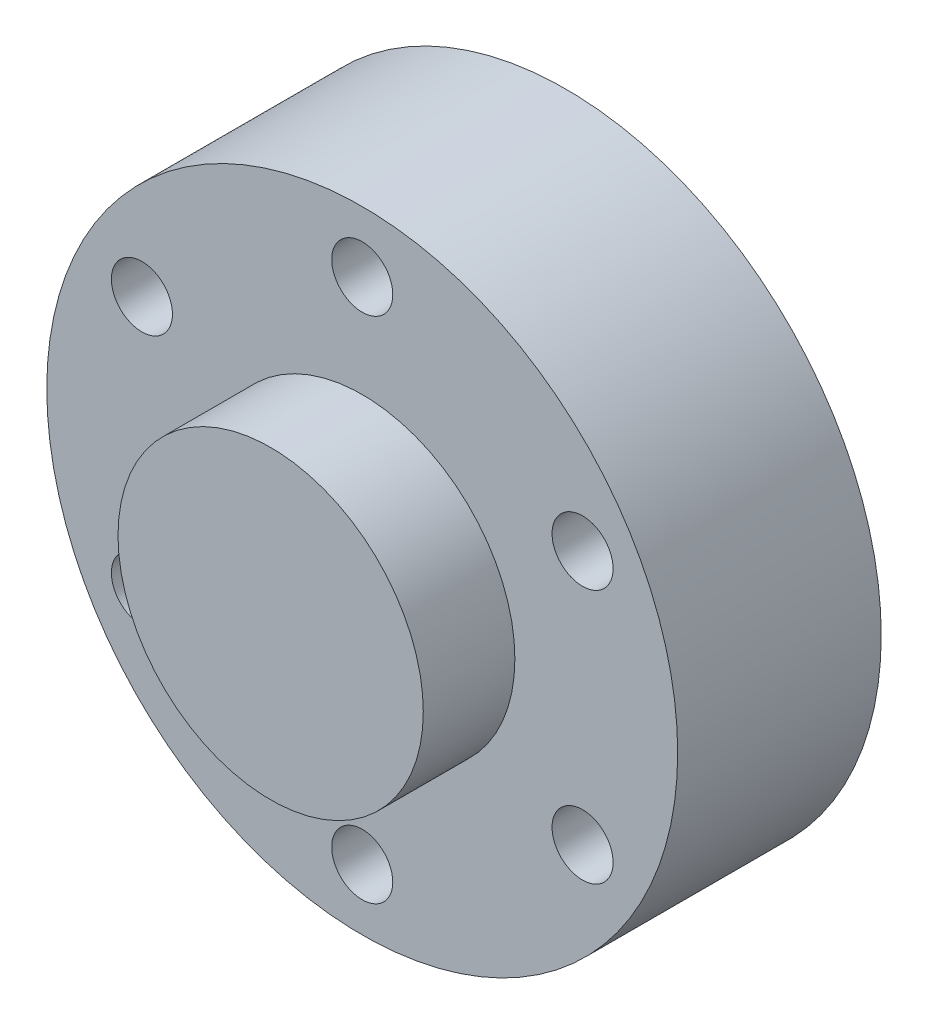
from build123d import *

# Parameters (mm, degrees)
SKETCH2_R           = 15.5
SKETCH2_R_2         = 1.5
BOSS_EXTRUDE1_DEPTH = 10
SKETCH3_R           = 7.5
BOSS_EXTRUDE2_DEPTH = 4.5
BOSS_EXTRUDE4_START = 4.5
SKETCH6_R           = 7.5
BOSS_EXTRUDE4_DEPTH = 4.5
SKETCH7_R           = 2
BOSS_EXTRUDE5_DEPTH = 1
FILLET2_R           = 0.05
CUT_EXTRUDE1_DEPTH  = 11


with BuildPart() as part:
    # Sketch2 → Boss-Extrude1 (new body)
    with BuildSketch(Plane.XY):
        Circle(SKETCH2_R)
        with Locations((0, -12.5)):
            Circle(SKETCH2_R_2, mode=Mode.SUBTRACT)
        with Locations((-10.825317547, -6.25)):
            Circle(SKETCH2_R_2, mode=Mode.SUBTRACT)
        with Locations((10.825317547, -6.25)):
            Circle(SKETCH2_R_2, mode=Mode.SUBTRACT)
        with Locations((-10.825317547, 6.25)):
            Circle(SKETCH2_R_2, mode=Mode.SUBTRACT)
        with Locations((0, 12.5)):
            Circle(SKETCH2_R_2, mode=Mode.SUBTRACT)
        with Locations((10.825317547, 6.25)):
            Circle(SKETCH2_R_2, mode=Mode.SUBTRACT)
    extrude(amount=BOSS_EXTRUDE1_DEPTH)

    # Sketch3 → Boss-Extrude2 (add)
    with BuildSketch(Plane.XY.offset(10)):
        Circle(SKETCH3_R)
    extrude(amount=BOSS_EXTRUDE2_DEPTH)

    # Sketch6 → Boss-Extrude4 (add)
    with BuildSketch(Plane(origin=(0, 0, 0), x_dir=(-1, 0, 0), z_dir=(0, 0, -1)).offset(BOSS_EXTRUDE4_START)):
        Circle(SKETCH6_R)
    extrude(amount=-BOSS_EXTRUDE4_DEPTH)

    # Sketch7 → Boss-Extrude5 (add)
    with BuildSketch(Plane(origin=(0, 0, -4.5), x_dir=(-1, 0, 0), z_dir=(0, 0, -1))):
        Circle(SKETCH7_R)
    extrude(amount=BOSS_EXTRUDE5_DEPTH)

    # Fillet2
    fillet2_edges = [part.edges().sort_by_distance(p)[0] for p in [
        (2, 0, -5.5),
    ]]
    fillet(fillet2_edges, radius=FILLET2_R)

    # Sketch9 → Cut-Extrude1 (cut)
    with BuildSketch(Plane(origin=(0, 0, -5.5), x_dir=(-1, 0, 0), z_dir=(0, 0, -1))):
        with BuildLine():
            Line((-1.224744871, 1.25), (1.224744871, 1.25))
            ThreePointArc((1.224744871, 1.25), (0, -1.75), (-1.224744871, 1.25))
        make_face()
    extrude(amount=-CUT_EXTRUDE1_DEPTH, mode=Mode.SUBTRACT)


solid = part.part
